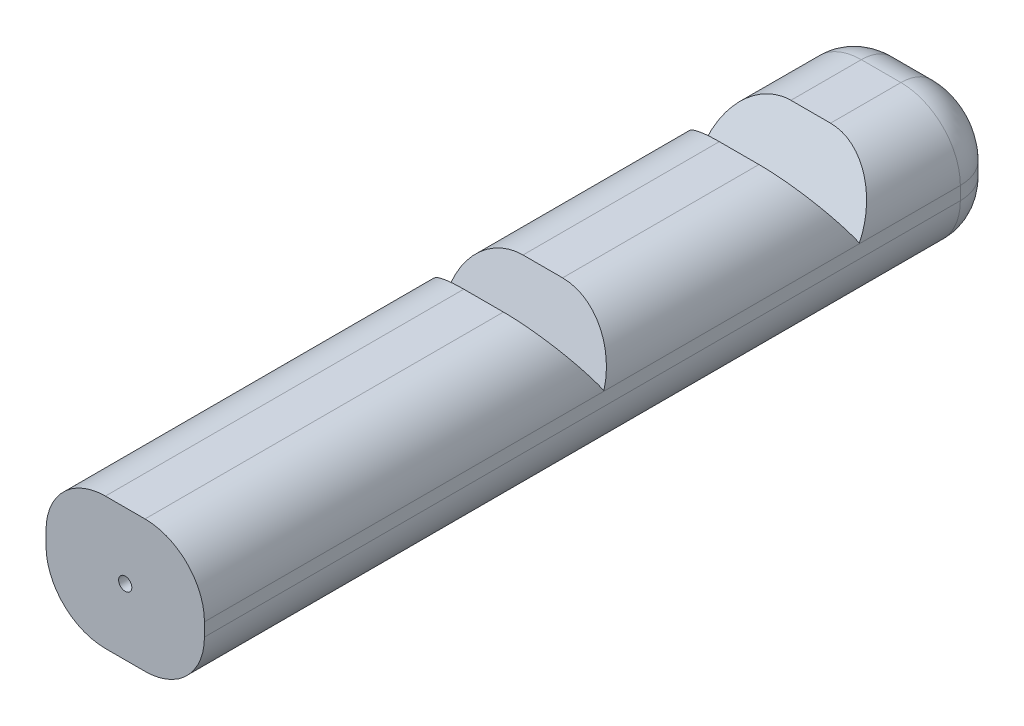
from build123d import *

# Parameters (mm, degrees)
BOSS_EXTRUDE1_DEPTH = 12
SKETCH2_R           = 0.5
CUT_EXTRUDE1_DEPTH  = 63.485196025
FILLET1_R           = 3.25
FILLET2_R           = 4.5


with BuildPart() as part:
    # Sketch1 → Boss-Extrude1 (new body)
    with BuildSketch(Plane(origin=(0, 0, 0), x_dir=(0, 0, -1), z_dir=(1, 0, 0))):
        Polygon((-24.577392289, 0), (35.923845073, 0), (35.923845073, 10), (27.343441845, 10), (25.026106666, 5.553221685), (21.918270736, 10), (7.051101363, 10), (5.673226392, 5.553221685), (2.565390462, 10), (-24.577392289, 10), align=None)
    extrude(amount=BOSS_EXTRUDE1_DEPTH)

    # Sketch2 → Cut-Extrude1 (cut, through all)
    with BuildSketch(Plane.XY.offset(24.577392289)):
        with Locations((6, 5)):
            Circle(SKETCH2_R)
    extrude(amount=-CUT_EXTRUDE1_DEPTH, mode=Mode.SUBTRACT)

    # Fillet1
    fillet1_edges = [part.edges().sort_by_distance(p)[0] for p in [
        (12, 5, -35.923845073),
        (0, 5, -35.923845073),
        (6, 10, -35.923845073),
        (6, 0, -35.923845073),
    ]]
    fillet(fillet1_edges, radius=FILLET1_R)

    # Fillet2
    # the kernel refuses this fillet: 4.5 mm, written as the material it takes off along each edge
    with BuildSketch(Plane(origin=(4.5, 4.5, -35.923845073), x_dir=(0, -1, 0), z_dir=(1, 0, 0))) as fillet2_piece_1:
        with BuildLine():
            CenterArc((1.25, -3.25), 3.25, 0, 90)
            Line((4.5, -3.25), (4.5, 0))
            Line((4.5, 0), (1.25, 0))
        make_face()
    revolve(axis=Axis((4.5, 4.5, -35.923845073), (0, 0, -1)), revolution_arc=90, mode=Mode.SUBTRACT)
    with BuildSketch(Plane(origin=(4.5, 5.5, -35.923845073), x_dir=(-1, 0, 0), z_dir=(0, -1, 0))) as fillet2_piece_2:
        with BuildLine():
            CenterArc((1.25, -3.25), 3.25, 0, 90)
            Line((4.5, -3.25), (4.5, 0))
            Line((4.5, 0), (1.25, 0))
        make_face()
    revolve(axis=Axis((4.5, 5.5, -35.923845073), (0, 0, -1)), revolution_arc=90, mode=Mode.SUBTRACT)
    with BuildSketch(Plane(origin=(7.5, 4.5, -35.923845073), x_dir=(1, 0, 0), z_dir=(0, 1, 0))) as fillet2_piece_3:
        with BuildLine():
            CenterArc((1.25, -3.25), 3.25, 0, 90)
            Line((4.5, -3.25), (4.5, 0))
            Line((4.5, 0), (1.25, 0))
        make_face()
    revolve(axis=Axis((7.5, 4.5, -35.923845073), (0, 0, -1)), revolution_arc=90, mode=Mode.SUBTRACT)
    with BuildSketch(Plane(origin=(7.5, 5.5, -35.923845073), x_dir=(0, 1, 0), z_dir=(-1, 0, 0))) as fillet2_piece_4:
        with BuildLine():
            CenterArc((1.25, -3.25), 3.25, 0, 90)
            Line((4.5, -3.25), (4.5, 0))
            Line((4.5, 0), (1.25, 0))
        make_face()
    revolve(axis=Axis((7.5, 5.5, -35.923845073), (0, 0, -1)), revolution_arc=90, mode=Mode.SUBTRACT)
    with BuildSketch(Plane(origin=(0, 10, -33.168270736), x_dir=(0, -1, 0), z_dir=(0, 0, 1))) as fillet2_piece_5:
        with BuildLine():
            CenterArc((FILLET2_R, FILLET2_R), FILLET2_R, 180, 90)
            Line((0, FILLET2_R), (0, 0))
            Line((0, 0), (FILLET2_R, 0))
        make_face()
    extrude(amount=37.367169374, mode=Mode.SUBTRACT)
    with BuildSketch(Plane(origin=(0, 0, 35.827392289), x_dir=(1, 0, 0), z_dir=(0, 0, -1))) as fillet2_piece_6:
        with BuildLine():
            CenterArc((FILLET2_R, -FILLET2_R), FILLET2_R, 90, 90)
            Line((0, -FILLET2_R), (0, 0))
            Line((0, 0), (FILLET2_R, 0))
        make_face()
    extrude(amount=71.751237362, mode=Mode.SUBTRACT)
    with BuildSketch(Plane(origin=(12, 10, -33.168270736), x_dir=(0, -1, 0), z_dir=(0, 0, 1))) as fillet2_piece_7:
        with BuildLine():
            CenterArc((FILLET2_R, -FILLET2_R), FILLET2_R, 90, 90)
            Line((0, -FILLET2_R), (0, 0))
            Line((0, 0), (FILLET2_R, 0))
        make_face()
    extrude(amount=37.367169374, mode=Mode.SUBTRACT)
    with BuildSketch(Plane(origin=(12, 10, -13.815390462), x_dir=(0, -1, 0), z_dir=(0, 0, 1))) as fillet2_piece_8:
        with BuildLine():
            CenterArc((FILLET2_R, -FILLET2_R), FILLET2_R, 90, 90)
            Line((0, -FILLET2_R), (0, 0))
            Line((0, 0), (FILLET2_R, 0))
        make_face()
    extrude(amount=49.642782751, mode=Mode.SUBTRACT)
    with BuildSketch(Plane(origin=(12, 10, -35.923845073), x_dir=(0, -1, 0), z_dir=(0, 0, 1))) as fillet2_piece_9:
        with BuildLine():
            CenterArc((FILLET2_R, -FILLET2_R), FILLET2_R, 90, 90)
            Line((0, -FILLET2_R), (0, 0))
            Line((0, 0), (FILLET2_R, 0))
        make_face()
    extrude(amount=19.830403228, mode=Mode.SUBTRACT)
    with BuildSketch(Plane(origin=(0, 10, -35.923845073), x_dir=(0, -1, 0), z_dir=(0, 0, 1))) as fillet2_piece_10:
        with BuildLine():
            CenterArc((FILLET2_R, FILLET2_R), FILLET2_R, 180, 90)
            Line((0, FILLET2_R), (0, 0))
            Line((0, 0), (FILLET2_R, 0))
        make_face()
    extrude(amount=19.830403228, mode=Mode.SUBTRACT)
    with BuildSketch(Plane(origin=(12, 0, 35.827392289), x_dir=(-1, 0, 0), z_dir=(0, 0, -1))) as fillet2_piece_11:
        with BuildLine():
            CenterArc((FILLET2_R, FILLET2_R), FILLET2_R, 180, 90)
            Line((0, FILLET2_R), (0, 0))
            Line((0, 0), (FILLET2_R, 0))
        make_face()
    extrude(amount=71.751237362, mode=Mode.SUBTRACT)
    with BuildSketch(Plane(origin=(0, 10, -13.815390462), x_dir=(0, -1, 0), z_dir=(0, 0, 1))) as fillet2_piece_12:
        with BuildLine():
            CenterArc((FILLET2_R, FILLET2_R), FILLET2_R, 180, 90)
            Line((0, FILLET2_R), (0, 0))
            Line((0, 0), (FILLET2_R, 0))
        make_face()
    extrude(amount=49.642782751, mode=Mode.SUBTRACT)


solid = part.part
